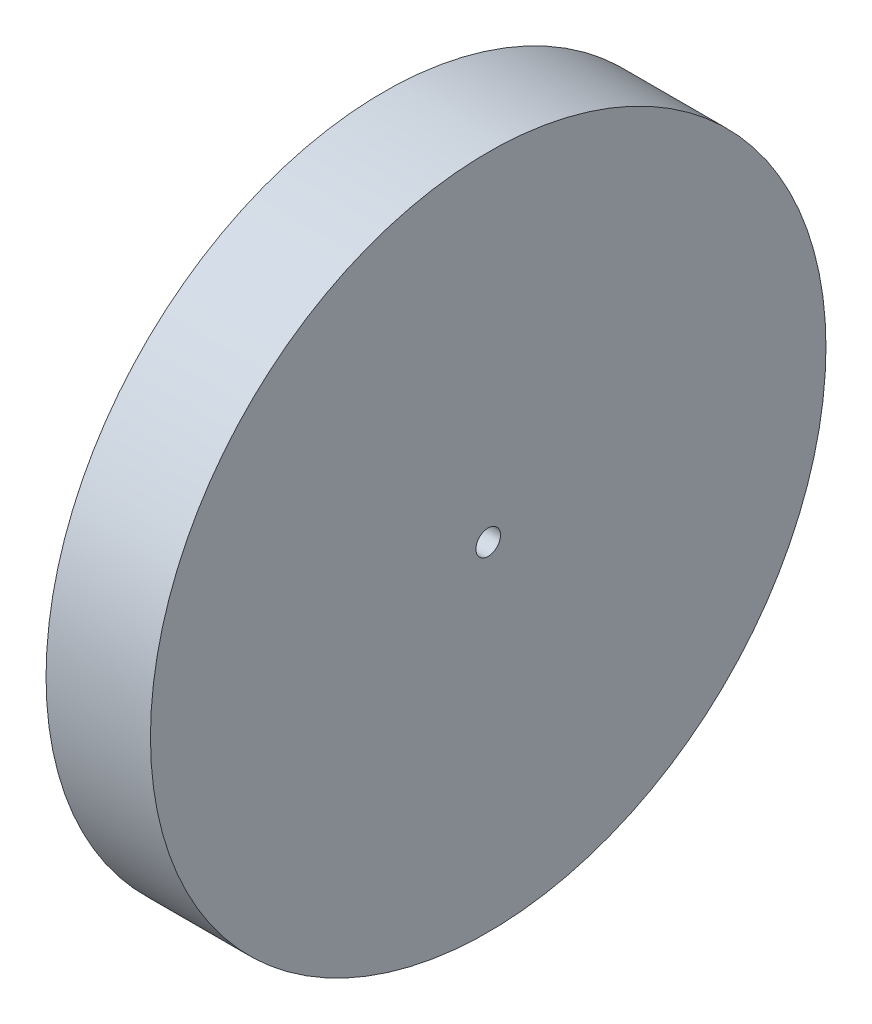
from build123d import *

# Parameters (mm, degrees)
BASPROSKE_W             = 12
BASPROSKE_H             = 12
TOOTHCUT_DEPTH          = 86.697141143
TEETHCUTS_COUNT         = 50
BOSS_EXTRU_1_START      = 5
ESQUISSE1_R             = 60
ESQUISSE1_R_2           = 2
BOSS_EXTRU_1_DEPTH      = 5
ENL_V_MAT_EXTRU_1_REACH = 88.539
ESQUISSE2_R             = 60
ESQUISSE2_R_2           = 55


with BuildPart() as part:
    # BasProSke → Base-Revolve (revolve)
    with BuildSketch(Plane(origin=(0, 0, 0), x_dir=(1, 0, 0), z_dir=(0, 1, 0))):
        with Locations((6, 54)):
            Rectangle(BASPROSKE_W, BASPROSKE_H)
    revolve(axis=Axis((-10, 0, 0), (1, 0, 0)))

    # TooCutSke → ToothCut (cut, through all)
    with BuildSketch(Plane(origin=(0, 0, 0), x_dir=(0, 0, -1), z_dir=(1, 0, 0))):
        with BuildLine():
            ThreePointArc((2.426707814, 47.913185391), (1.628356337, 50.250450788), (0.603274723, 52.497533853))
            ThreePointArc((0.603274723, 52.497533853), (0, 52.501), (-0.603274723, 52.497533853))
            ThreePointArc((-0.603274723, 52.497533853), (-1.628356337, 50.250450788), (-2.426707814, 47.913185391))
            ThreePointArc((-2.426707814, 47.913185391), (0, 47.9746), (2.426707814, 47.913185391))
        make_face()
    toothcut = extrude(amount=TOOTHCUT_DEPTH, mode=Mode.SUBTRACT)

    # TeethCuts: ToothCut ×50 about axis
    teethcuts_axis = Axis((-10, 0, 0), (1, 0, 0))
    for i in range(1, TEETHCUTS_COUNT):
        add(toothcut.rotate(teethcuts_axis, i * 360 / TEETHCUTS_COUNT), mode=Mode.SUBTRACT)

    # Esquisse1 → Boss.-Extru.1 (add)
    with BuildSketch(Plane(origin=(12, 0, 0), x_dir=(0, 0, -1), z_dir=(1, 0, 0)).offset(BOSS_EXTRU_1_START)):
        Circle(ESQUISSE1_R)
        Circle(ESQUISSE1_R_2, mode=Mode.SUBTRACT)
    extrude(amount=-BOSS_EXTRU_1_DEPTH)

    # Esquisse2 → Enlèv. mat.-Extru.1 (cut, up to next)
    with BuildSketch(Plane(origin=(17, 0, 0), x_dir=(0, 0, -1), z_dir=(1, 0, 0)), mode=Mode.PRIVATE) as enl_v_mat_extru_1_sk1:
        Circle(ESQUISSE2_R)
        Circle(ESQUISSE2_R_2, mode=Mode.SUBTRACT)
    enl_v_mat_extru_1_tool1 = extrude(enl_v_mat_extru_1_sk1.sketch, amount=-ENL_V_MAT_EXTRU_1_REACH, mode=Mode.PRIVATE) & part.part
    add(enl_v_mat_extru_1_tool1.solids().sort_by_distance((17, 0, 58.302944))[0], mode=Mode.SUBTRACT)


solid = part.part
